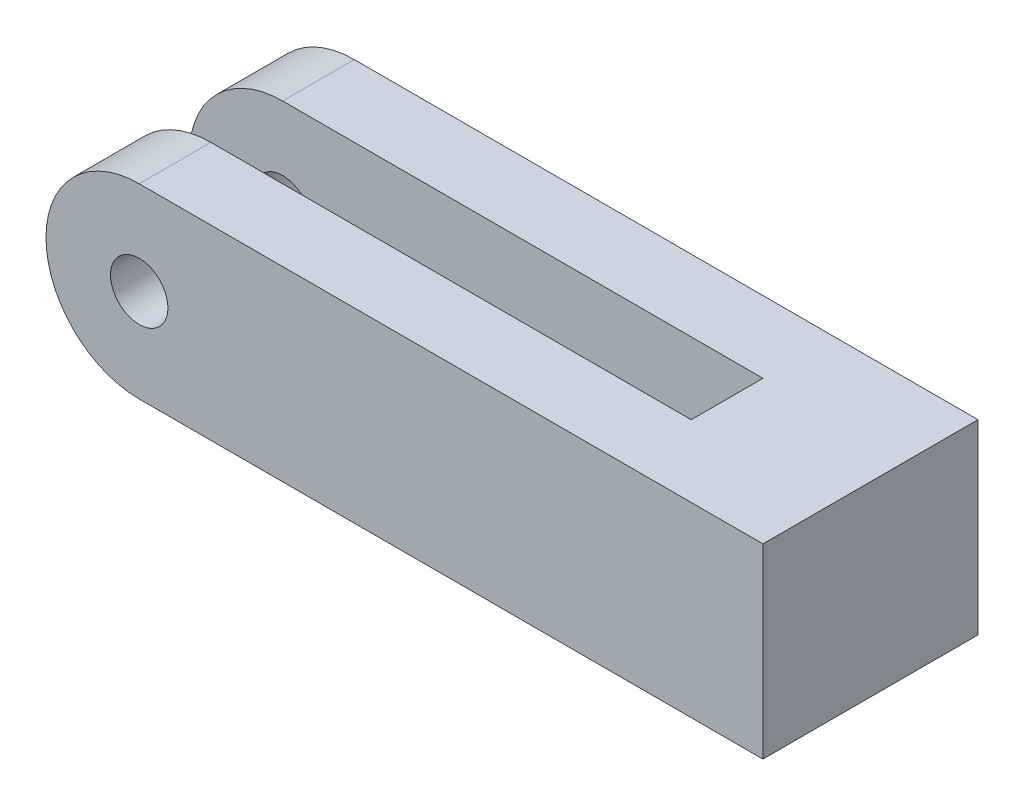
from build123d import *

# Parameters (mm, degrees)
SKETCH_1_W                = 120
SKETCH_1_H                = 26
EXTRUDE_1_DEPTH           = 15
CUT_EXTRUDE_START         = -15
CUT_EXTRUDE_8_DEPTH       = 15
CUT_EXTRUDE_9_DEPTH       = 64.198101237
CUT_EXTRUDE_9_DEPTH_BACK  = 5
CUT_EXTRUDE_10_DEPTH      = 63.20128616
CUT_EXTRUDE_10_DEPTH_BACK = 63.20128616
SKETCH_7_R                = 4


# Read off the part's stored shape, not the designer's step: 切除-拉伸8
with BuildPart() as part:
    # 草图1 → 凸台-拉伸1 (new body)
    with BuildSketch(Plane.XY):
        Rectangle(SKETCH_1_W, SKETCH_1_H)
    extrude(amount=EXTRUDE_1_DEPTH)

    # 切除-拉伸8 outline → 切除-拉伸8 (cut)
    with BuildSketch(Plane(origin=(0, 0, 0), x_dir=(-1, 0, 0), z_dir=(0, 0, -1)).offset(CUT_EXTRUDE_START)):
        with BuildLine():
            Line((60, 13), (27, 13))
            ThreePointArc((27, 13), (40, 0), (27, -13))
            Line((27, -13), (60, -13))
            Line((60, -13), (60, 13))
        make_face()
    extrude(amount=CUT_EXTRUDE_8_DEPTH, mode=Mode.SUBTRACT)

    # 草图6 → 切除-拉伸9 (cut, two sides: drawn at the far end of the back side and taken through both)
    with BuildSketch(Plane(origin=(0, 0, 0), x_dir=(-1, 0, 0), z_dir=(0, 0, -1)).offset(-CUT_EXTRUDE_9_DEPTH_BACK)):
        Polygon((-40, 191.237926759), (-40, 13), (-40, -13), (-40, -191.237926759), (316.475853517, -191.237926759), (316.475853517, 191.237926759), align=None)
    extrude(amount=CUT_EXTRUDE_9_DEPTH + CUT_EXTRUDE_9_DEPTH_BACK, mode=Mode.SUBTRACT)

    # 草图7 → 切除-拉伸10 (cut, two sides: drawn at the far end of the back side and taken through both)
    with BuildSketch(Plane(origin=(0, 0, 5), x_dir=(-1, 0, 0), z_dir=(0, 0, -1)).offset(-CUT_EXTRUDE_10_DEPTH_BACK)):
        with Locations((27, 0)):
            Circle(SKETCH_7_R)
    extrude(amount=CUT_EXTRUDE_10_DEPTH + CUT_EXTRUDE_10_DEPTH_BACK, mode=Mode.SUBTRACT)

    # 镜向2: part across plane


with BuildPart() as part_1:
    add(part.part)
    add(part.part.mirror(Plane(origin=(0, 0, 0), x_dir=(1, 0, 0), z_dir=(0, 0, -1))))


solid = part_1.part
